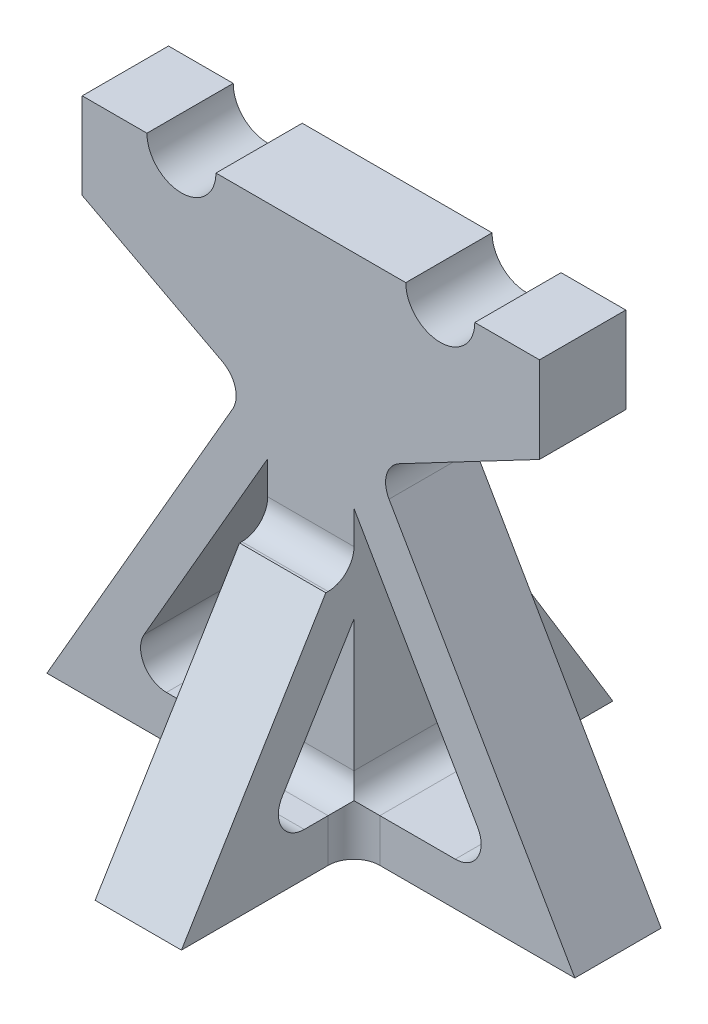
from build123d import *

# Parameters (mm, degrees)
BOSS_EXTRUDE1_DEPTH      = 12.7
BOSS_EXTRUDE1_DEPTH_BACK = 12.7
BOSS_EXTRUDE2_DEPTH      = 12.7
BOSS_EXTRUDE2_DEPTH_BACK = 12.7
FILLET1_R                = 7.62
FILLET2_R                = 7.62
FILLET3_R                = 7.62


with BuildPart() as part:
    # Sketch1 → Boss-Extrude1 (new, two sides: drawn at the far end of the back side and taken through both)
    with BuildSketch(Plane.XY.offset(-BOSS_EXTRUDE1_DEPTH_BACK)):
        with BuildLine():
            Line((27.94, 152.4), (-27.94, 152.4))
            ThreePointArc((-27.94, 152.4), (-38.1, 142.24), (-48.26, 152.4))
            Line((-48.26, 152.4), (-67.31, 152.4))
            Line((-67.31, 152.4), (-67.31, 127))
            Line((-67.31, 127), (-19.05, 101.6))
            Line((-19.05, 101.6), (-77.70878735, 0))
            Line((-77.70878735, 0), (77.70878735, 0))
            Line((77.70878735, 0), (19.05, 101.6))
            Line((19.05, 101.6), (67.31, 127))
            Line((67.31, 127), (67.31, 152.4))
            Line((67.31, 152.4), (48.26, 152.4))
            ThreePointArc((48.26, 152.4), (38.1, 142.24), (27.94, 152.4))
        make_face()
        Polygon((-55.711742094, 12.7), (-12.7, 12.7), (-12.7, 87.198522628), align=None, mode=Mode.SUBTRACT)
        Polygon((12.7, 87.198522628), (12.7, 12.7), (55.711742094, 12.7), align=None, mode=Mode.SUBTRACT)
    extrude(amount=BOSS_EXTRUDE1_DEPTH + BOSS_EXTRUDE1_DEPTH_BACK)

    # Sketch2 → Boss-Extrude2 (add, two sides: drawn at the far end of the back side and taken through both)
    with BuildSketch(Plane(origin=(0, 0, 0), x_dir=(0, 0, -1), z_dir=(1, 0, 0)).offset(-BOSS_EXTRUDE2_DEPTH_BACK)):
        Polygon((20.992545931, 69.85), (63.5, 0), (-63.5, 0), (-20.992545931, 69.85), align=None)
        Polygon((12.7, 59.046917663), (40.904573712, 12.7), (12.7, 12.7), align=None, mode=Mode.SUBTRACT)
        Polygon((-12.7, 59.046917663), (-12.7, 12.7), (-40.904573712, 12.7), align=None, mode=Mode.SUBTRACT)
    extrude(amount=BOSS_EXTRUDE2_DEPTH + BOSS_EXTRUDE2_DEPTH_BACK)

    # Fillet1
    fillet1_edges = [part.edges().sort_by_distance(p)[0] for p in [
        (0, 69.85, -12.7),
        (0, 69.85, 12.7),
    ]]
    fillet(fillet1_edges, radius=FILLET1_R)

    # Fillet2
    # the kernel refuses this fillet: 7.62 mm, written as the material it adds along each edge
    with BuildSketch(Plane(origin=(12.7, 12.7, -12.7), x_dir=(0, 0, -1), z_dir=(0, -1, 0)), Plane(origin=(12.7, 12.7, 12.7), x_dir=(1, 0, 0), z_dir=(0, -1, 0))) as fillet2_piece_1:
        with BuildLine():
            CenterArc((FILLET2_R, FILLET2_R), FILLET2_R, 180, 90)
            Line((0, FILLET2_R), (0, 0))
            Line((0, 0), (FILLET2_R, 0))
        make_face()
    extrude(amount=12.7)
    with BuildSketch(Plane(origin=(-12.7, 12.7, -12.7), x_dir=(0, 0, -1), z_dir=(0, -1, 0)), Plane(origin=(-12.7, 12.7, 12.7), x_dir=(-1, 0, 0), z_dir=(0, -1, 0))) as fillet2_piece_2:
        with BuildLine():
            CenterArc((FILLET2_R, -FILLET2_R), FILLET2_R, 90, 90)
            Line((0, -FILLET2_R), (0, 0))
            Line((0, 0), (FILLET2_R, 0))
        make_face()
    extrude(amount=12.7)
    with BuildSketch(Plane(origin=(12.7, 12.7, -40.904573712), x_dir=(0, 0, 1), z_dir=(-1, 0, 0)), Plane(origin=(12.7, 12.7, 40.904573712), x_dir=(0, 0.8542525273339658, -0.5198582687074736), z_dir=(-1, 0, 0))) as fillet2_piece_3:
        with BuildLine():
            CenterArc((FILLET2_R * 1.77916742424, FILLET2_R), FILLET2_R, 148.677255076, 121.322744924)
            Line((FILLET2_R * 0.924914896906, FILLET2_R * 1.51985826871), (0, 0))
            Line((0, 0), (FILLET2_R * 1.77916742424, 0))
        make_face()
    extrude(amount=25.4)
    with BuildSketch(Plane(origin=(19.05, 101.6, -12.7), x_dir=(0.4999999999999972, -0.8660254037844403, 0), z_dir=(0, 0, 1))) as fillet2_piece_4:
        with BuildLine():
            CenterArc((FILLET2_R * 1.03990652475, FILLET2_R), FILLET2_R, 177.758540601, 92.241459399)
            Line((FILLET2_R * 0.0406716474833, FILLET2_R * 1.03911086864), (0, 0))
            Line((0, 0), (FILLET2_R * 1.03990652475, 0))
        make_face()
    extrude(amount=25.4)
    with BuildSketch(Plane(origin=(-19.05, 101.6, -12.7), x_dir=(-0.4999999999999979, -0.8660254037844399, 0), z_dir=(0, 0, 1))) as fillet2_piece_5:
        with BuildLine():
            CenterArc((FILLET2_R * 1.03990652475, -FILLET2_R), FILLET2_R, 90, 92.241459399)
            Line((FILLET2_R * 0.0406716474833, -FILLET2_R * 1.03911086864), (0, 0))
            Line((0, 0), (FILLET2_R * 1.03990652475, 0))
        make_face()
    extrude(amount=25.4)
    with BuildSketch(Plane(origin=(-55.711742094, 12.7, 12.7), x_dir=(0.49999999999999845, 0.8660254037844396, 0), z_dir=(0, 0, -1)), Plane(origin=(55.711742094, 12.7, -12.7), x_dir=(-0.4999999999999981, 0.8660254037844397, 0), z_dir=(0, 0, 1))) as fillet2_piece_6:
        with BuildLine():
            CenterArc((FILLET2_R * 1.73205080757, FILLET2_R), FILLET2_R, 150, 120)
            Line((FILLET2_R * 0.866025403784, FILLET2_R * 1.5), (0, 0))
            Line((0, 0), (FILLET2_R * 1.73205080757, 0))
        make_face()
    extrude(amount=25.4)

    # Fillet3
    # the kernel refuses this fillet: 7.62 mm, written as the material it adds along each edge
    with BuildSketch(Plane(origin=(12.7, 12.7, -12.7), x_dir=(1, 0, 0), z_dir=(0, 0, 1)), Plane(origin=(12.7, 12.7, 12.7), x_dir=(0, 0, 1), z_dir=(-1, 0, 0))) as fillet3_piece_1:
        with BuildLine():
            CenterArc((FILLET3_R, FILLET3_R), FILLET3_R, 180, 90)
            Line((0, FILLET3_R), (0, 0))
            Line((0, 0), (FILLET3_R, 0))
        make_face()
    extrude(amount=25.4)
    with BuildSketch(Plane(origin=(12.7, 12.7, -12.7), x_dir=(0, 0, -1), z_dir=(-1, 0, 0)), Plane(origin=(-12.7, 12.7, -12.7), x_dir=(-1, 0, 0), z_dir=(0, 0, 1))) as fillet3_piece_2:
        with BuildLine():
            CenterArc((FILLET3_R, -FILLET3_R), FILLET3_R, 90, 90)
            Line((0, -FILLET3_R), (0, 0))
            Line((0, 0), (FILLET3_R, 0))
        make_face()
    extrude(amount=25.4)
    with BuildSketch(Plane(origin=(31.75, 12.7, -12.7), x_dir=(0, 0, -1), z_dir=(-1, 0, 0))) as fillet3_piece_3a_section:
        with BuildLine():
            CenterArc((FILLET3_R, -FILLET3_R), FILLET3_R, 90, 90)
            Line((0, -FILLET3_R), (0, 0))
            Line((0, 0), (FILLET3_R, 0))
        make_face()
    fillet3_piece_3a = extrude(amount=44.45, mode=Mode.PRIVATE)
    fillet3_piece_3a = split(fillet3_piece_3a, bisect_by=Plane(origin=(12.7, 14.893212432, -14.893212432), z_dir=(1, 0, 0)), keep=Keep.TOP, mode=Mode.PRIVATE)
    fillet3_piece_3a = fillet3_piece_3a - Plane(origin=(20.32, 14.893212432, -20.32), x_dir=(0, 0, -1), z_dir=(0, 1, 0)) * Cylinder(7.62, 120, mode=Mode.PRIVATE)
    with BuildSketch(Plane(origin=(12.7, 12.7, -31.75), x_dir=(1, 0, 0), z_dir=(0, 0, 1))) as fillet3_piece_3b_section:
        with BuildLine():
            CenterArc((FILLET3_R, FILLET3_R), FILLET3_R, 180, 90)
            Line((0, FILLET3_R), (0, 0))
            Line((0, 0), (FILLET3_R, 0))
        make_face()
    fillet3_piece_3b = extrude(amount=44.45, mode=Mode.PRIVATE)
    fillet3_piece_3b = fillet3_piece_3b - Plane(origin=(20.32, 13.018424072, -20.32), x_dir=(0, 0, -1), z_dir=(0, 1, 0)) * Cylinder(7.62, 120, mode=Mode.PRIVATE)
    fillet3_piece_3b = split(fillet3_piece_3b, bisect_by=Plane(origin=(17.997172091, 13.018424072, -12.7), z_dir=(0, 0, -1)), keep=Keep.TOP, mode=Mode.PRIVATE)
    fillet3_piece_3b = fillet3_piece_3b - Plane(origin=(17.997172091, 20.32, -27.347317939), x_dir=(0, 0, 1), z_dir=(1, 0, 0)) * Cylinder(7.62, 120, mode=Mode.PRIVATE)
    fillet3_piece_3 = fillet3_piece_3a & fillet3_piece_3b
    add(fillet3_piece_3)
    with BuildSketch(Plane(origin=(31.75, 12.7, 12.7), x_dir=(0, 0, 1), z_dir=(-1, 0, 0))) as fillet3_piece_4a_section:
        with BuildLine():
            CenterArc((FILLET3_R, FILLET3_R), FILLET3_R, 180, 90)
            Line((0, FILLET3_R), (0, 0))
            Line((0, 0), (FILLET3_R, 0))
        make_face()
    fillet3_piece_4a = extrude(amount=44.45, mode=Mode.PRIVATE)
    fillet3_piece_4a = fillet3_piece_4a - Plane(origin=(20.32, 14.893212432, 20.32), x_dir=(1, 0, 0), z_dir=(0, 1, 0)) * Cylinder(7.62, 120, mode=Mode.PRIVATE)
    fillet3_piece_4a = split(fillet3_piece_4a, bisect_by=Plane(origin=(12.7, 14.893212432, 14.893212432), z_dir=(1, 0, 0)), keep=Keep.TOP, mode=Mode.PRIVATE)
    with BuildSketch(Plane(origin=(12.7, 12.7, -12.7), x_dir=(1, 0, 0), z_dir=(0, 0, 1))) as fillet3_piece_4b_section:
        with BuildLine():
            CenterArc((FILLET3_R, FILLET3_R), FILLET3_R, 180, 90)
            Line((0, FILLET3_R), (0, 0))
            Line((0, 0), (FILLET3_R, 0))
        make_face()
    fillet3_piece_4b = extrude(amount=44.45, mode=Mode.PRIVATE)
    fillet3_piece_4b = split(fillet3_piece_4b, bisect_by=Plane(origin=(14.346750692, 12.818924561, 12.7), z_dir=(0, 0, 1)), keep=Keep.TOP, mode=Mode.PRIVATE)
    fillet3_piece_4b = fillet3_piece_4b - Plane(origin=(20.32, 12.818924561, 20.32), x_dir=(1, 0, 0), z_dir=(0, 1, 0)) * Cylinder(7.62, 120, mode=Mode.PRIVATE)
    fillet3_piece_4b = fillet3_piece_4b - Plane(origin=(14.346750692, 20.32, 27.347317939), x_dir=(0, 0.8542525273341854, -0.5198582687071128), z_dir=(1, 0, 0)) * Cylinder(7.62, 120, mode=Mode.PRIVATE)
    fillet3_piece_4 = fillet3_piece_4a & fillet3_piece_4b
    add(fillet3_piece_4)
    with BuildSketch(Plane(origin=(-12.7, 12.7, -31.75), x_dir=(-1, 0, 0), z_dir=(0, 0, 1))) as fillet3_piece_5a_section:
        with BuildLine():
            CenterArc((FILLET3_R, -FILLET3_R), FILLET3_R, 90, 90)
            Line((0, -FILLET3_R), (0, 0))
            Line((0, 0), (FILLET3_R, 0))
        make_face()
    fillet3_piece_5a = extrude(amount=44.45, mode=Mode.PRIVATE)
    fillet3_piece_5a = split(fillet3_piece_5a, bisect_by=Plane(origin=(-17.997172063, 13.018423982, -12.7), z_dir=(0, 0, -1)), keep=Keep.TOP, mode=Mode.PRIVATE)
    fillet3_piece_5a = fillet3_piece_5a - Plane(origin=(-20.32, 13.018423982, -20.32), x_dir=(0, 0, -1), z_dir=(0, 1, 0)) * Cylinder(7.62, 120, mode=Mode.PRIVATE)
    fillet3_piece_5a = fillet3_piece_5a - Plane(origin=(-17.997172063, 20.32, -27.347317939), x_dir=(0, 0, 1), z_dir=(1, 0, 0)) * Cylinder(7.62, 120, mode=Mode.PRIVATE)
    with BuildSketch(Plane(origin=(12.7, 12.7, -12.7), x_dir=(0, 0, -1), z_dir=(-1, 0, 0))) as fillet3_piece_5b_section:
        with BuildLine():
            CenterArc((FILLET3_R, -FILLET3_R), FILLET3_R, 90, 90)
            Line((0, -FILLET3_R), (0, 0))
            Line((0, 0), (FILLET3_R, 0))
        make_face()
    fillet3_piece_5b = extrude(amount=44.45, mode=Mode.PRIVATE)
    fillet3_piece_5b = fillet3_piece_5b - Plane(origin=(-20.32, 20.265363421, -20.32), x_dir=(0, 0, -1), z_dir=(0, 1, 0)) * Cylinder(7.62, 120, mode=Mode.PRIVATE)
    fillet3_piece_5b = split(fillet3_piece_5b, bisect_by=Plane(origin=(-12.7, 20.265363421, -12.6238), z_dir=(-1, 0, 0)), keep=Keep.TOP, mode=Mode.PRIVATE)
    fillet3_piece_5 = fillet3_piece_5a & fillet3_piece_5b
    add(fillet3_piece_5)
    with BuildSketch(Plane(origin=(-12.7, 12.7, -12.7), x_dir=(-1, 0, 0), z_dir=(0, 0, 1))) as fillet3_piece_6a_section:
        with BuildLine():
            CenterArc((FILLET3_R, -FILLET3_R), FILLET3_R, 90, 90)
            Line((0, -FILLET3_R), (0, 0))
            Line((0, 0), (FILLET3_R, 0))
        make_face()
    fillet3_piece_6a = extrude(amount=44.45, mode=Mode.PRIVATE)
    fillet3_piece_6a = fillet3_piece_6a - Plane(origin=(-20.32, 16.148179969, 20.32), x_dir=(-1, 0, 0), z_dir=(0, 1, 0)) * Cylinder(7.62, 120, mode=Mode.PRIVATE)
    fillet3_piece_6a = split(fillet3_piece_6a, bisect_by=Plane(origin=(-12.657850187, 16.148179969, 12.7), z_dir=(0, 0, 1)), keep=Keep.TOP, mode=Mode.PRIVATE)
    fillet3_piece_6a = fillet3_piece_6a - Plane(origin=(-12.657850187, 20.32, 27.347317939), x_dir=(0, 0.8542525273341854, -0.5198582687071128), z_dir=(1, 0, 0)) * Cylinder(7.62, 120, mode=Mode.PRIVATE)
    with BuildSketch(Plane(origin=(12.7, 12.7, 12.7), x_dir=(0, 0, 1), z_dir=(-1, 0, 0))) as fillet3_piece_6b_section:
        with BuildLine():
            CenterArc((FILLET3_R, FILLET3_R), FILLET3_R, 180, 90)
            Line((0, FILLET3_R), (0, 0))
            Line((0, 0), (FILLET3_R, 0))
        make_face()
    fillet3_piece_6b = extrude(amount=44.45, mode=Mode.PRIVATE)
    fillet3_piece_6b = split(fillet3_piece_6b, bisect_by=Plane(origin=(-12.7, 20.265363421, 12.6238), z_dir=(-1, 0, 0)), keep=Keep.TOP, mode=Mode.PRIVATE)
    fillet3_piece_6b = fillet3_piece_6b - Plane(origin=(-20.32, 20.265363421, 20.32), x_dir=(-1, 0, 0), z_dir=(0, 1, 0)) * Cylinder(7.62, 120, mode=Mode.PRIVATE)
    fillet3_piece_6 = fillet3_piece_6a & fillet3_piece_6b
    add(fillet3_piece_6)


solid = part.part
